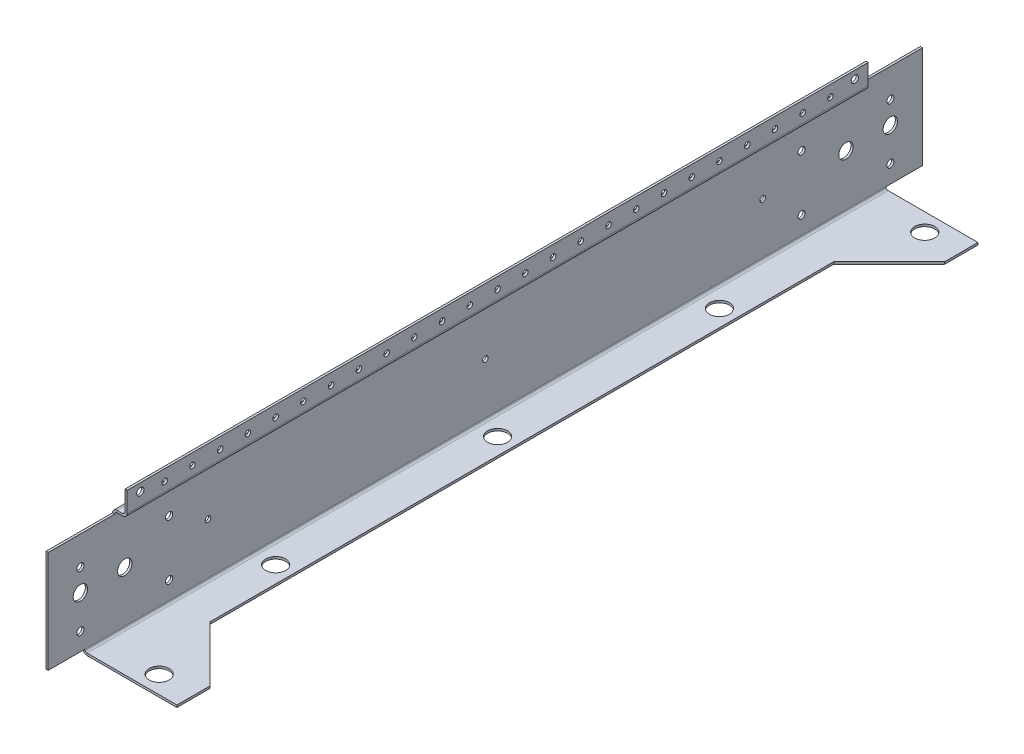
from build123d import *

# Parameters (mm, degrees)
SM_BASE_FLANGE_1_DEPTH     = 394
SKETCH_6_W                 = 13
SKETCH_6_H                 = 60
CUT_EXTRUDE_1_DEPTH        = 24
CUT_EXTRUDE_START          = -4
SKETCH_7_W                 = 81
SKETCH_7_H                 = 33
SKETCH_7_W_2               = 4
CUT_EXTRUDE_2_DEPTH        = 4
SKETCH_8_R                 = 6.5
SKETCH_8_R_2               = 3.25
SKETCH_8_R_3               = 2.5
CUT_EXTRUDE_3_DEPTH        = 10
SKETCH_9_R                 = 3.25
CUT_EXTRUDE_4_DEPTH        = 10
SKETCH_10_R                = 9
CUT_EXTRUDE_5_DEPTH        = 10
SKETCH_11_R                = 2.5
CUT_EXTRUDE_6_DEPTH        = 10
PATTERN_LINEAR_1_COUNT     = 13
PATTERN_LINEAR_1_PITCH     = 25
PATTERN_LINEAR_1_COL_COUNT = 13
PATTERN_LINEAR_1_COL_PITCH = 25
MOVE_START                 = -120
MOVE_BODY_1_DEPTH          = 2
MOVE_BODY_1_2_DEPTH        = 2


# Read off the part's stored shape, not the designer's step: Тело-Переместить/Копировать1
# Sheet-metal steps are written as plain solids
with BuildPart() as part:
    # Sketch 1 → Базовая кромка1 (new, symmetric)
    with BuildSketch(Plane.XY):
        with BuildLine():
            Line((0, 0), (0, -18))
            ThreePointArc((0, -18), (-1.171572875, -20.828427125), (-4, -22))
            Line((-4, -22), (-9, -22))
            ThreePointArc((-9, -22), (-10.414213562, -22.585786438), (-11, -24))
            Line((-11, -24), (-11, -116))
            ThreePointArc((-11, -116), (-10.414213562, -117.414213562), (-9, -118))
            Line((-9, -118), (72, -118))
            Line((72, -118), (72, -120))
            Line((72, -120), (-9, -120))
            ThreePointArc((-9, -120), (-11.828427125, -118.828427125), (-13, -116))
            Line((-13, -116), (-13, -24))
            ThreePointArc((-13, -24), (-11.828427125, -21.171572875), (-9, -20))
            Line((-9, -20), (-4, -20))
            ThreePointArc((-4, -20), (-2.585786438, -19.414213562), (-2, -18))
            Line((-2, -18), (-2, 0))
            Line((-2, 0), (0, 0))
        make_face()
    extrude(amount=SM_BASE_FLANGE_1_DEPTH, both=True)

    # Эскиз6 → Вырез-Вытянуть1 (cut)
    with BuildSketch(Plane(origin=(0, 0, 0), x_dir=(1, 0, 0), z_dir=(0, 1, 0))):
        with Locations((-6.5, -364)):
            Rectangle(SKETCH_6_W, SKETCH_6_H)
        with Locations((-6.5, 364)):
            Rectangle(SKETCH_6_W, SKETCH_6_H)
    extrude(amount=-CUT_EXTRUDE_1_DEPTH, mode=Mode.SUBTRACT)

    # Эскиз7 → Вырез-Вытянуть2 (cut)
    with BuildSketch(Plane.XZ.offset(120).offset(CUT_EXTRUDE_START)):
        with Locations((31.5, -377.5)):
            Rectangle(SKETCH_7_W, SKETCH_7_H)
        Polygon((22, -281), (72, -331), (72, 331), (22, 281), align=None)
        with Locations((31.5, 377.5)):
            Rectangle(SKETCH_7_W, SKETCH_7_H)
        with Locations((-11, -377.5)):
            Rectangle(SKETCH_7_W_2, SKETCH_7_H)
        with Locations((-11, 377.5)):
            Rectangle(SKETCH_7_W_2, SKETCH_7_H)
    extrude(amount=CUT_EXTRUDE_2_DEPTH, mode=Mode.SUBTRACT)

    # Эскиз8 → Вырез-Вытянуть3 (cut)
    with BuildSketch(Plane.ZY.offset(13)):
        with Locations(Location((-365, -70, 0), (0, 0, 270))):
            Circle(SKETCH_8_R)
        with Locations(Location((-325, -70, 0), (0, 0, 270))):
            Circle(SKETCH_8_R)
        with Locations(Location((-365, -50, 0), (0, 0, 270))):
            Circle(SKETCH_8_R_2)
        with Locations(Location((-365, -100, 0), (0, 0, 270))):
            Circle(SKETCH_8_R_2)
        with Locations(Location((-285, -50, 0), (0, 0, 270))):
            Circle(SKETCH_8_R_2)
        with Locations(Location((-285, -100, 0), (0, 0, 270))):
            Circle(SKETCH_8_R_2)
        with Locations(Location((285, -100, 0), (0, 0, 90))):
            Circle(SKETCH_8_R_2)
        with Locations(Location((285, -50, 0), (0, 0, 90))):
            Circle(SKETCH_8_R_2)
        with Locations(Location((365, -100, 0), (0, 0, 90))):
            Circle(SKETCH_8_R_2)
        with Locations(Location((365, -50, 0), (0, 0, 90))):
            Circle(SKETCH_8_R_2)
        with Locations(Location((325, -70, 0), (0, 0, 90))):
            Circle(SKETCH_8_R)
        with Locations(Location((365, -70, 0), (0, 0, 90))):
            Circle(SKETCH_8_R)
        with Locations(Location((-250, -70, 0), (0, 0, 270))):
            Circle(SKETCH_8_R_3)
        with Locations(Location((0, -70, 0), (0, 0, 270))):
            Circle(SKETCH_8_R_3)
        with Locations(Location((250, -70, 0), (0, 0, 270))):
            Circle(SKETCH_8_R_3)
    extrude(amount=-CUT_EXTRUDE_3_DEPTH, mode=Mode.SUBTRACT)

    # Эскиз9 → Вырез-Вытянуть4 (cut)
    with BuildSketch(Plane.ZY.offset(2)):
        with Locations(Location((-322, -7, 0), (0, 0, 270))):
            Circle(SKETCH_9_R)
        with Locations(Location((322, -7, 0), (0, 0, 90))):
            Circle(SKETCH_9_R)
    extrude(amount=-CUT_EXTRUDE_4_DEPTH, mode=Mode.SUBTRACT)

    # Эскиз10 → Вырез-Вытянуть5 (cut)
    with BuildSketch(Plane.XZ.offset(120)):
        with Locations(Location((40, -345, 0), (0, 0, 270))):
            Circle(SKETCH_10_R)
        with Locations(Location((40, 345, 0), (0, 0, 270))):
            Circle(SKETCH_10_R)
        with Locations(Location((7, -7, 0), (0, 0, 270))):
            Circle(SKETCH_10_R)
        with Locations(Location((7, 193, 0), (0, 0, 270))):
            Circle(SKETCH_10_R)
        with Locations(Location((7, -207, 0), (0, 0, 270))):
            Circle(SKETCH_10_R)
    extrude(amount=-CUT_EXTRUDE_5_DEPTH, mode=Mode.SUBTRACT)

    # Эскиз11 → Вырез-Вытянуть6 (cut)
    with BuildSketch(Plane.ZY.offset(2)):
        with Locations(Location((0, -10, 0), (0, 0, 270))):
            Circle(SKETCH_11_R)
    cut_extrude_6 = extrude(amount=-CUT_EXTRUDE_6_DEPTH, mode=Mode.SUBTRACT)

    # Линейный массив1: Вырез-Вытянуть6 ×13
    with Locations(*[(0, 0, i * PATTERN_LINEAR_1_PITCH) for i in range(1, PATTERN_LINEAR_1_COUNT)]):
        add(cut_extrude_6, mode=Mode.SUBTRACT)

    # Линейный массив1 col: Вырез-Вытянуть6 ×13
    with Locations(*[(0, 0, -i * PATTERN_LINEAR_1_COL_PITCH) for i in range(1, PATTERN_LINEAR_1_COL_COUNT)]):
        add(cut_extrude_6, mode=Mode.SUBTRACT)

    # Move Body 1 outline → Move Body 1 (cut)
    with BuildSketch(Plane(origin=(0, 0, 0), x_dir=(1, 0, 0), z_dir=(0, 1, 0)).offset(MOVE_START)):
        with BuildLine():
            ThreePointArc((1.343145751, 200), (7, 184), (12.656854249, 200))
            ThreePointArc((12.656854249, 200), (7, 198), (1.343145751, 200))
        make_face()
        with BuildLine():
            ThreePointArc((1.343145751, 0), (7, -16), (12.656854249, 0))
            ThreePointArc((12.656854249, 0), (7, -2), (1.343145751, 0))
        make_face()
        with BuildLine():
            ThreePointArc((1.343145751, -200), (7, -216), (12.656854249, -200))
            ThreePointArc((12.656854249, -200), (7, -202), (1.343145751, -200))
        make_face()
    extrude(amount=MOVE_BODY_1_DEPTH, mode=Mode.SUBTRACT)

    # Move Body 1 2 outline → Move Body 1 2 (add)
    with BuildSketch(Plane(origin=(0, 0, 0), x_dir=(1, 0, 0), z_dir=(0, 1, 0)).offset(MOVE_START)):
        with BuildLine():
            ThreePointArc((1.343145751, 200), (7, 202), (12.656854249, 200))
            ThreePointArc((12.656854249, 200), (7, 216), (1.343145751, 200))
        make_face()
        with BuildLine():
            ThreePointArc((1.343145751, 0), (7, 2), (12.656854249, 0))
            ThreePointArc((12.656854249, 0), (7, 16), (1.343145751, 0))
        make_face()
        with BuildLine():
            ThreePointArc((1.343145751, -200), (7, -198), (12.656854249, -200))
            ThreePointArc((12.656854249, -200), (7, -184), (1.343145751, -200))
        make_face()
    extrude(amount=MOVE_BODY_1_2_DEPTH)


solid = part.part
